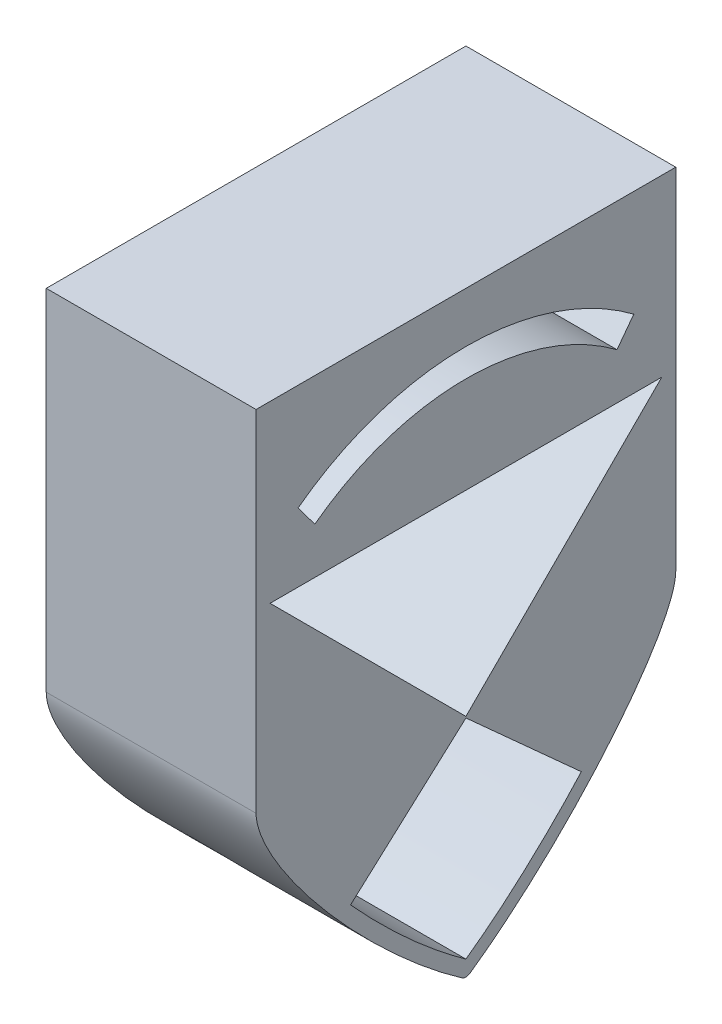
from build123d import *

# Parameters (mm, degrees)
SKETCH3_W           = 30
SKETCH3_H           = 45
BOSS_EXTRUDE1_DEPTH = 15
FILLET1_SIZE        = 20
CUT_EXTRUDE3_DEPTH  = 55.331916325
CUT_EXTRUDE8_DEPTH  = 55.331916325
CUT_EXTRUDE9_DEPTH  = 55.331916325
SKETCH25_R          = 5
CUT_EXTRUDE11_DEPTH = 7
FILLET2_R           = 0.5


with BuildPart() as part:
    # Sketch3 → Boss-Extrude1 (new body)
    with BuildSketch(Plane(origin=(0, 0, 0), x_dir=(0, 0, -1), z_dir=(1, 0, 0))):
        with Locations((15, -22.5)):
            Rectangle(SKETCH3_W, SKETCH3_H)
    extrude(amount=BOSS_EXTRUDE1_DEPTH)

    # Fillet1
    # a fillet whose section is not a circle: 20 mm, written as the material it takes off along each edge
    with BuildSketch(Plane(origin=(-50, -45, -30), x_dir=(0, 1, 0), z_dir=(1, 0, 0)), Plane(origin=(-50, -45, 0), x_dir=(0, 0, -1), z_dir=(1, 0, 0))) as fillet1_piece_1:
        with BuildLine():
            Bezier((FILLET1_SIZE, 0), (0, 0), (0, FILLET1_SIZE), weights=[1, 0.23570226, 1])
            Line((0, FILLET1_SIZE), (0, 0))
            Line((0, 0), (FILLET1_SIZE, 0))
        make_face()
    extrude(amount=115, mode=Mode.SUBTRACT)

    # Sketch13 → Cut-Extrude3 (cut, through all)
    with BuildSketch(Plane(origin=(15, 0, 0), x_dir=(0, 0, -1), z_dir=(1, 0, 0))):
        Polygon((1, -12.5), (29, -12.5), (15, -26.5), align=None)
    extrude(amount=-CUT_EXTRUDE3_DEPTH, mode=Mode.SUBTRACT)

    # Sketch21 → Cut-Extrude8 (cut, through all)
    with BuildSketch(Plane(origin=(15, 0, 0), x_dir=(0, 0, -1), z_dir=(1, 0, 0))):
        with BuildLine():
            Line((20.999099472, -32.017092941), (15, -26.6))
            Line((15, -26.6), (9.197837651, -31.8392914))
            Line((9.197837651, -31.8392914), (6.751716779, -34.048112747))
            add(Edge.make_bspline(
                [(6.751716779, -34.048112747), (7.137670563, -34.475530569), (7.537017115, -34.903979725), (7.94976684, -35.333427086)],
                knots=[0.510805621, 0.510805621, 0.510805621, 0.510805621, 0.58717305, 0.58717305, 0.58717305, 0.58717305], degree=3))
            add(Edge.make_bspline(
                [(7.94976684, -35.333427086), (8.154213463, -35.546144521), (8.361948556, -35.759106865), (8.74730745, -36.148443801), (8.924817998, -36.325675997), (9.632110907, -37.023426184), (10.866534028, -38.197036851), (12.552696064, -39.658637771), (13.705600922, -40.565790559), (14.17200535, -40.917925916), (14.185722754, -40.928272256), (14.211686476, -40.947827457), (14.276533102, -40.99660607), (14.547571615, -41.199178962), (14.800672356, -41.38335147), (14.999893178, -41.525081651)],
                knots=[0.58717305, 0.58717305, 0.58717305, 0.58717305, 0.625, 0.625, 0.65625, 0.65625, 0.75, 0.875, 0.95703125, 0.95703125, 0.958984375, 0.958984375, 0.9609375, 0.96875, 1, 1, 1, 1], degree=3))
            add(Edge.make_bspline(
                [(14.999893178, -41.525081651), (15.199321685, -41.383202546), (15.452729149, -41.198806282), (15.737075559, -40.986289622), (15.815081437, -40.9275387), (15.85416041, -40.898031283), (15.864256494, -40.890397912), (16.318047278, -40.547025448), (17.4556848, -39.650959263), (19.12477944, -38.204529259), (20.355024133, -37.035590602), (21.060002804, -36.340635733), (21.237350271, -36.163716309), (21.656669951, -35.740378843), (21.89625213, -35.494384393), (22.131454088, -35.24870359)],
                knots=[0, 0, 0, 0, 0.03125, 0.0390625, 0.04296875, 0.04296875, 0.044921875, 0.044921875, 0.125, 0.25, 0.34375, 0.34375, 0.375, 0.375, 0.41847678, 0.41847678, 0.41847678, 0.41847678], degree=3))
            add(Edge.make_bspline(
                [(22.131454088, -35.24870359), (22.51540209, -34.847649728), (22.88767772, -34.447431671), (23.24828941, -34.048076256)],
                knots=[0.41847678, 0.41847678, 0.41847678, 0.41847678, 0.489449076, 0.489449076, 0.489449076, 0.489449076], degree=3))
            Line((23.24828941, -34.048076256), (20.999099472, -32.017092941))
        make_face()
    extrude(amount=-CUT_EXTRUDE8_DEPTH, mode=Mode.SUBTRACT)

    # Sketch23 → Cut-Extrude9 (cut, through all)
    with BuildSketch(Plane(origin=(15, 0, 0), x_dir=(0, 0, -1), z_dir=(1, 0, 0))):
        with BuildLine():
            Line((27, -7.6), (25.8, -9.2))
            ThreePointArc((25.8, -9.2), (15, -5.6), (4.2, -9.2))
            Line((4.2, -9.2), (3, -7.6))
            ThreePointArc((3, -7.6), (15, -3.6), (27, -7.6))
        make_face()
    extrude(amount=-CUT_EXTRUDE9_DEPTH, mode=Mode.SUBTRACT)

    # Sketch25 → Cut-Extrude11 (cut)
    with BuildSketch(Plane(origin=(0, 0, -30), x_dir=(-1, 0, 0), z_dir=(0, 0, -1))):
        with Locations(Location((-7.5, -25, 0), (0, 0, 90))):
            Circle(SKETCH25_R)
    extrude(amount=-CUT_EXTRUDE11_DEPTH, mode=Mode.SUBTRACT)

    # Fillet2
    fillet2_edges = [part.edges().sort_by_distance(p)[0] for p in [
        (7.5, -42.742918852, -15),
    ]]
    fillet(fillet2_edges, radius=FILLET2_R)


solid = part.part
